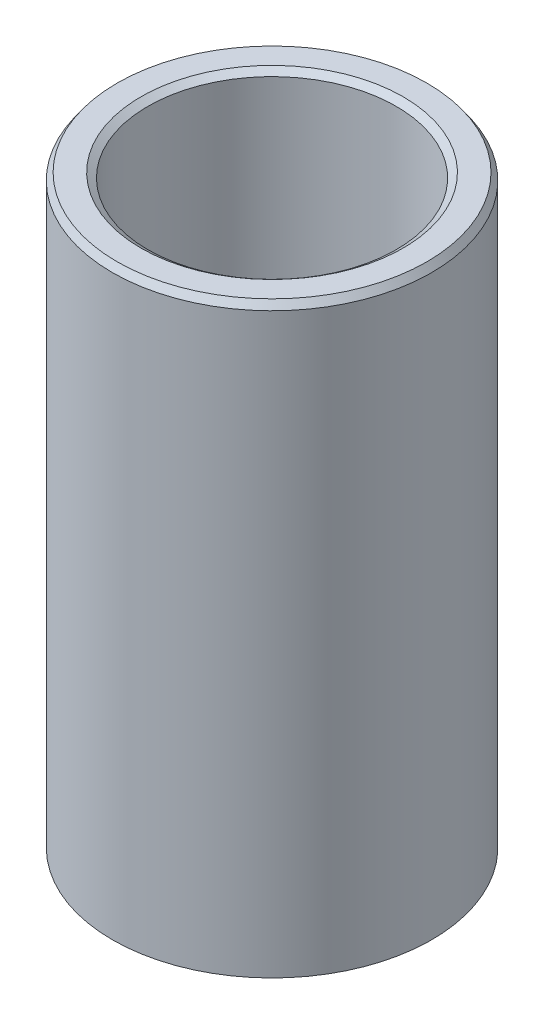
from build123d import *
from OCP.BRepFilletAPI import BRepFilletAPI_MakeChamfer

# Parameters (mm, degrees)
SKETCH1_R           = 37.5
BOSS_EXTRUDE1_DEPTH = 138.474839878
SKETCH2_R           = 29.168421337
CUT_EXTRUDE1_DEPTH  = 149.282774722
CHAMFER1_SIZE       = 1.628298397
CHAMFER1_SIZE2      = 1.132564616


with BuildPart() as part:
    # Sketch1 → Boss-Extrude1 (new body)
    with BuildSketch(Plane(origin=(0, 0, 0), x_dir=(1, 0, 0), z_dir=(0, 1, 0))):
        Circle(SKETCH1_R)
    extrude(amount=BOSS_EXTRUDE1_DEPTH)

    # Sketch2 → Cut-Extrude1 (cut, through all)
    with BuildSketch(Plane(origin=(0, 0, 0), x_dir=(1, 0, 0), z_dir=(0, 1, 0))):
        Circle(SKETCH2_R)
    extrude(amount=CUT_EXTRUDE1_DEPTH, mode=Mode.SUBTRACT)

    # Chamfer1: one chamfer whose edges measure the first distance from different faces: ONE call of the kernel's chamfer builder (chamfer() names one face for all edges)
    chamfer1_edges_1 = [part.edges().sort_by_distance(p)[0] for p in [
        (-29.168421337, 138.474839878, 0),
    ]]
    chamfer1_side_1 = [part.faces().sort_by_distance(p)[0] for p in [
        (-36.439339828, 138.474839878, 0),
    ]]
    chamfer1_edges_2 = [part.edges().sort_by_distance(p)[0] for p in [
        (-29.168421337, 0, 0),
    ]]
    chamfer1_side_2 = [part.faces().sort_by_distance(p)[0] for p in [
        (-29.168421337, 69.237419939, 0),
    ]]
    chamfer1_edges_3 = [part.edges().sort_by_distance(p)[0] for p in [
        (-37.5, 0, 0),
    ]]
    chamfer1_side_3 = [part.faces().sort_by_distance(p)[0] for p in [
        (-36.439339828, 0, 0),
    ]]
    chamfer1_edges_4 = [part.edges().sort_by_distance(p)[0] for p in [
        (-37.5, 138.474839878, 0),
    ]]
    chamfer1_side_4 = [part.faces().sort_by_distance(p)[0] for p in [
        (-37.5, 69.237419939, 0),
    ]]
    chamfer1 = BRepFilletAPI_MakeChamfer(part.part.solid().wrapped)
    for e in chamfer1_edges_1:
        chamfer1.Add(CHAMFER1_SIZE, CHAMFER1_SIZE2, e.wrapped, chamfer1_side_1[0].wrapped)  # the first distance lies on this face
    for e in chamfer1_edges_2:
        chamfer1.Add(CHAMFER1_SIZE, CHAMFER1_SIZE2, e.wrapped, chamfer1_side_2[0].wrapped)  # the first distance lies on this face
    for e in chamfer1_edges_3:
        chamfer1.Add(CHAMFER1_SIZE, CHAMFER1_SIZE2, e.wrapped, chamfer1_side_3[0].wrapped)  # the first distance lies on this face
    for e in chamfer1_edges_4:
        chamfer1.Add(CHAMFER1_SIZE, CHAMFER1_SIZE2, e.wrapped, chamfer1_side_4[0].wrapped)  # the first distance lies on this face
    add(Compound.cast(chamfer1.Shape()), mode=Mode.REPLACE)


solid = part.part
